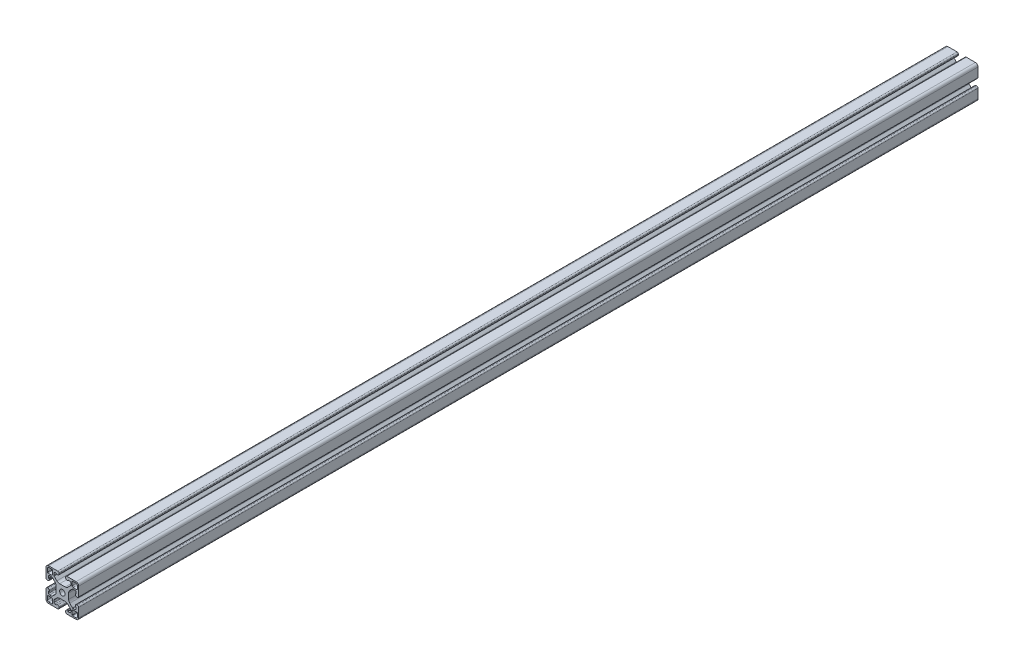
from build123d import *

# Parameters (mm, degrees)
SKETCH2_R      = 3.405
EXTRUDE1_DEPTH = 550


with BuildPart() as part:
    # Sketch2 → Extrude1 (new, symmetric)
    with BuildSketch(Plane.XY):
        with BuildLine():
            Line((-16.82, 20), (-5.635, 20))
            ThreePointArc((-5.635, 20), (-4.524842354, 19.540157646), (-4.065, 18.43))
            Line((-4.065, 18.43), (-4.065, 17.51))
            ThreePointArc((-4.065, 17.51), (-4.524842354, 16.399842354), (-5.635, 15.94))
            Line((-5.635, 15.94), (-6.855, 15.94))
            Line((-6.855, 15.94), (-6.855, 16.77))
            Line((-6.855, 16.77), (-9.015, 16.77))
            ThreePointArc((-9.015, 16.77), (-9.913025612, 16.398025612), (-10.285, 15.5))
            Line((-10.285, 15.5), (-10.285, 12.987102448))
            ThreePointArc((-10.285, 12.987102448), (-10.217252784, 12.646514194), (-10.024325035, 12.357777413))
            Line((-10.024325035, 12.357777413), (-6.737790411, 9.071242789))
            ThreePointArc((-6.737790411, 9.071242789), (-5.196779505, 8.041572221), (-3.379033201, 7.68))
            Line((-3.379033201, 7.68), (3.379033201, 7.68))
            ThreePointArc((3.379033201, 7.68), (5.196779505, 8.041572221), (6.737790411, 9.071242789))
            Line((6.737790411, 9.071242789), (10.024325035, 12.357777413))
            ThreePointArc((10.024325035, 12.357777413), (10.217252784, 12.646514194), (10.285, 12.987102448))
            Line((10.285, 12.987102448), (10.285, 15.5))
            ThreePointArc((10.285, 15.5), (9.913025612, 16.398025612), (9.015, 16.77))
            Line((9.015, 16.77), (6.855, 16.77))
            Line((6.855, 16.77), (6.855, 15.94))
            Line((6.855, 15.94), (5.635, 15.94))
            ThreePointArc((5.635, 15.94), (4.524842354, 16.399842354), (4.065, 17.51))
            Line((4.065, 17.51), (4.065, 18.43))
            ThreePointArc((4.065, 18.43), (4.524842354, 19.540157646), (5.635, 20))
            Line((5.635, 20), (16.82, 20))
            ThreePointArc((16.82, 20), (19.068599564, 19.068599564), (20, 16.82))
            Line((20, 16.82), (20, 5.635))
            ThreePointArc((20, 5.635), (19.540157646, 4.524842354), (18.43, 4.065))
            Line((18.43, 4.065), (17.51, 4.065))
            ThreePointArc((17.51, 4.065), (16.399842354, 4.524842354), (15.94, 5.635))
            Line((15.94, 5.635), (15.94, 6.855))
            Line((15.94, 6.855), (16.77, 6.855))
            Line((16.77, 6.855), (16.77, 9.015))
            ThreePointArc((16.77, 9.015), (16.398025612, 9.913025612), (15.5, 10.285))
            Line((15.5, 10.285), (12.987102448, 10.285))
            ThreePointArc((12.987102448, 10.285), (12.646514194, 10.217252784), (12.357777413, 10.024325035))
            Line((12.357777413, 10.024325035), (9.071242789, 6.737790411))
            ThreePointArc((9.071242789, 6.737790411), (8.041572221, 5.196779505), (7.68, 3.379033201))
            Line((7.68, 3.379033201), (7.68, -3.379033201))
            ThreePointArc((7.68, -3.379033201), (8.041572221, -5.196779505), (9.071242789, -6.737790411))
            Line((9.071242789, -6.737790411), (12.357777413, -10.024325035))
            ThreePointArc((12.357777413, -10.024325035), (12.646514194, -10.217252784), (12.987102448, -10.285))
            Line((12.987102448, -10.285), (15.5, -10.285))
            ThreePointArc((15.5, -10.285), (16.398025612, -9.913025612), (16.77, -9.015))
            Line((16.77, -9.015), (16.77, -6.855))
            Line((16.77, -6.855), (15.94, -6.855))
            Line((15.94, -6.855), (15.94, -5.635))
            ThreePointArc((15.94, -5.635), (16.399842354, -4.524842354), (17.51, -4.065))
            Line((17.51, -4.065), (18.43, -4.065))
            ThreePointArc((18.43, -4.065), (19.540157646, -4.524842354), (20, -5.635))
            Line((20, -5.635), (20, -16.82))
            ThreePointArc((20, -16.82), (19.068599564, -19.068599564), (16.82, -20))
            Line((16.82, -20), (5.635, -20))
            ThreePointArc((5.635, -20), (4.524842354, -19.540157646), (4.065, -18.43))
            Line((4.065, -18.43), (4.065, -17.51))
            ThreePointArc((4.065, -17.51), (4.524842354, -16.399842354), (5.635, -15.94))
            Line((5.635, -15.94), (6.855, -15.94))
            Line((6.855, -15.94), (6.855, -16.77))
            Line((6.855, -16.77), (9.015, -16.77))
            ThreePointArc((9.015, -16.77), (9.913025612, -16.398025612), (10.285, -15.5))
            Line((10.285, -15.5), (10.285, -12.987102448))
            ThreePointArc((10.285, -12.987102448), (10.217252784, -12.646514194), (10.024325035, -12.357777413))
            Line((10.024325035, -12.357777413), (6.737790411, -9.071242789))
            ThreePointArc((6.737790411, -9.071242789), (5.196779505, -8.041572221), (3.379033201, -7.68))
            Line((3.379033201, -7.68), (-3.379033201, -7.68))
            ThreePointArc((-3.379033201, -7.68), (-5.196779505, -8.041572221), (-6.737790411, -9.071242789))
            Line((-6.737790411, -9.071242789), (-10.024325035, -12.357777413))
            ThreePointArc((-10.024325035, -12.357777413), (-10.217252784, -12.646514194), (-10.285, -12.987102448))
            Line((-10.285, -12.987102448), (-10.285, -15.5))
            ThreePointArc((-10.285, -15.5), (-9.913025612, -16.398025612), (-9.015, -16.77))
            Line((-9.015, -16.77), (-6.855, -16.77))
            Line((-6.855, -16.77), (-6.855, -15.94))
            Line((-6.855, -15.94), (-5.635, -15.94))
            ThreePointArc((-5.635, -15.94), (-4.524842354, -16.399842354), (-4.065, -17.51))
            Line((-4.065, -17.51), (-4.065, -18.43))
            ThreePointArc((-4.065, -18.43), (-4.524842354, -19.540157646), (-5.635, -20))
            Line((-5.635, -20), (-16.82, -20))
            ThreePointArc((-16.82, -20), (-19.068599564, -19.068599564), (-20, -16.82))
            Line((-20, -16.82), (-20, -5.635))
            ThreePointArc((-20, -5.635), (-19.540157646, -4.524842354), (-18.43, -4.065))
            Line((-18.43, -4.065), (-17.51, -4.065))
            ThreePointArc((-17.51, -4.065), (-16.399842354, -4.524842354), (-15.94, -5.635))
            Line((-15.94, -5.635), (-15.94, -6.855))
            Line((-15.94, -6.855), (-16.77, -6.855))
            Line((-16.77, -6.855), (-16.77, -9.015))
            ThreePointArc((-16.77, -9.015), (-16.398025612, -9.913025612), (-15.5, -10.285))
            Line((-15.5, -10.285), (-12.987102448, -10.285))
            ThreePointArc((-12.987102448, -10.285), (-12.646514194, -10.217252784), (-12.357777413, -10.024325035))
            Line((-12.357777413, -10.024325035), (-9.071242789, -6.737790411))
            ThreePointArc((-9.071242789, -6.737790411), (-8.041572221, -5.196779505), (-7.68, -3.379033201))
            Line((-7.68, -3.379033201), (-7.68, 3.379033201))
            ThreePointArc((-7.68, 3.379033201), (-8.041572221, 5.196779505), (-9.071242789, 6.737790411))
            Line((-9.071242789, 6.737790411), (-12.357777413, 10.024325035))
            ThreePointArc((-12.357777413, 10.024325035), (-12.646514194, 10.217252784), (-12.987102448, 10.285))
            Line((-12.987102448, 10.285), (-15.5, 10.285))
            ThreePointArc((-15.5, 10.285), (-16.398025612, 9.913025612), (-16.77, 9.015))
            Line((-16.77, 9.015), (-16.77, 6.855))
            Line((-16.77, 6.855), (-15.94, 6.855))
            Line((-15.94, 6.855), (-15.94, 5.635))
            ThreePointArc((-15.94, 5.635), (-16.399842354, 4.524842354), (-17.51, 4.065))
            Line((-17.51, 4.065), (-18.43, 4.065))
            ThreePointArc((-18.43, 4.065), (-19.540157646, 4.524842354), (-20, 5.635))
            Line((-20, 5.635), (-20, 16.82))
            ThreePointArc((-20, 16.82), (-19.068599564, 19.068599564), (-16.82, 20))
        make_face()
        Circle(SKETCH2_R, mode=Mode.SUBTRACT)
        with BuildLine():
            Line((-16.78, 18.35), (-12.575, 18.35))
            ThreePointArc((-12.575, 18.35), (-12.12245166, 18.16254834), (-11.935, 17.71))
            Line((-11.935, 17.71), (-11.935, 13.205))
            ThreePointArc((-11.935, 13.205), (-12.306974388, 12.306974388), (-13.205, 11.935))
            Line((-13.205, 11.935), (-17.71, 11.935))
            ThreePointArc((-17.71, 11.935), (-18.16254834, 12.12245166), (-18.35, 12.575))
            Line((-18.35, 12.575), (-18.35, 16.78))
            ThreePointArc((-18.35, 16.78), (-17.890157646, 17.890157646), (-16.78, 18.35))
        make_face(mode=Mode.SUBTRACT)
        with BuildLine():
            Line((-18.35, -16.78), (-18.35, -12.575))
            ThreePointArc((-18.35, -12.575), (-18.16254834, -12.12245166), (-17.71, -11.935))
            Line((-17.71, -11.935), (-13.205, -11.935))
            ThreePointArc((-13.205, -11.935), (-12.306974388, -12.306974388), (-11.935, -13.205))
            Line((-11.935, -13.205), (-11.935, -17.71))
            ThreePointArc((-11.935, -17.71), (-12.12245166, -18.16254834), (-12.575, -18.35))
            Line((-12.575, -18.35), (-16.78, -18.35))
            ThreePointArc((-16.78, -18.35), (-17.890157646, -17.890157646), (-18.35, -16.78))
        make_face(mode=Mode.SUBTRACT)
        with BuildLine():
            Line((16.78, -18.35), (12.575, -18.35))
            ThreePointArc((12.575, -18.35), (12.12245166, -18.16254834), (11.935, -17.71))
            Line((11.935, -17.71), (11.935, -13.205))
            ThreePointArc((11.935, -13.205), (12.306974388, -12.306974388), (13.205, -11.935))
            Line((13.205, -11.935), (17.71, -11.935))
            ThreePointArc((17.71, -11.935), (18.16254834, -12.12245166), (18.35, -12.575))
            Line((18.35, -12.575), (18.35, -16.78))
            ThreePointArc((18.35, -16.78), (17.890157646, -17.890157646), (16.78, -18.35))
        make_face(mode=Mode.SUBTRACT)
        with BuildLine():
            Line((18.35, 16.78), (18.35, 12.575))
            ThreePointArc((18.35, 12.575), (18.16254834, 12.12245166), (17.71, 11.935))
            Line((17.71, 11.935), (13.205, 11.935))
            ThreePointArc((13.205, 11.935), (12.306974388, 12.306974388), (11.935, 13.205))
            Line((11.935, 13.205), (11.935, 17.71))
            ThreePointArc((11.935, 17.71), (12.12245166, 18.16254834), (12.575, 18.35))
            Line((12.575, 18.35), (16.78, 18.35))
            ThreePointArc((16.78, 18.35), (17.890157646, 17.890157646), (18.35, 16.78))
        make_face(mode=Mode.SUBTRACT)
    extrude(amount=EXTRUDE1_DEPTH, both=True)


solid = part.part
